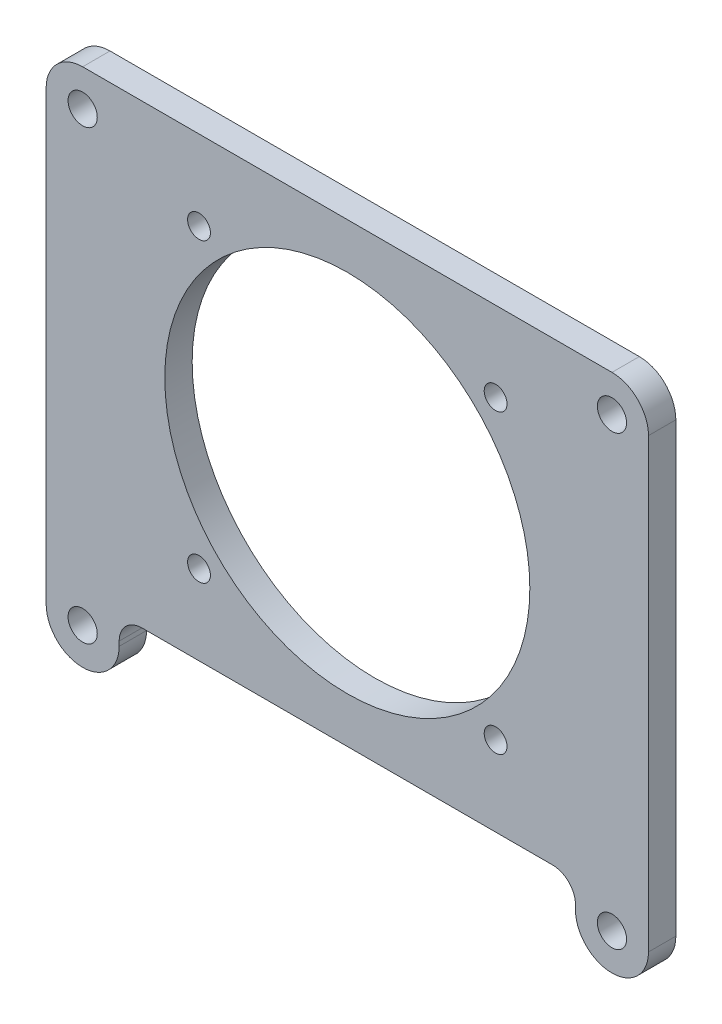
from build123d import *

# Parameters (mm, degrees)
SKETCH_1_R          = 1.6
EXTRUDE_1_DEPTH     = 3
SKETCH_2_R          = 1.25
SKETCH_2_R_2        = 20
CUT_EXTRUDE_1_DEPTH = 60.983331018


with BuildPart() as part:
    # ｽｹｯﾁ1 → ﾎﾞｽ - 押し出し1 (new body)
    with BuildSketch(Plane.XY):
        with BuildLine():
            Line((22.5, 0), (-22.5, 0))
            ThreePointArc((-22.5, 0), (-24.267766953, -0.732233047), (-25, -2.5))
            Line((-25, -2.5), (-25, -3))
            ThreePointArc((-25, -3), (-29, -7), (-33, -3))
            Line((-33, -3), (-33, 46))
            ThreePointArc((-33, 46), (-31.828427125, 48.828427125), (-29, 50))
            Line((-29, 50), (29, 50))
            ThreePointArc((29, 50), (31.828427125, 48.828427125), (33, 46))
            Line((33, 46), (33, -3))
            ThreePointArc((33, -3), (29, -7), (25, -3))
            Line((25, -3), (25, -2.5))
            ThreePointArc((25, -2.5), (24.267766953, -0.732233047), (22.5, 0))
        make_face()
        with Locations((-29, -3)):
            Circle(SKETCH_1_R, mode=Mode.SUBTRACT)
        with Locations((-29, 46)):
            Circle(SKETCH_1_R, mode=Mode.SUBTRACT)
        with Locations((29, 46)):
            Circle(SKETCH_1_R, mode=Mode.SUBTRACT)
        with Locations((29, -3)):
            Circle(SKETCH_1_R, mode=Mode.SUBTRACT)
    extrude(amount=EXTRUDE_1_DEPTH)

    # ｽｹｯﾁ2 → ｶｯﾄ - 押し出し1 (cut, through all)
    with BuildSketch(Plane.XY.offset(3)):
        with Locations((-16.25, 41.25)):
            Circle(SKETCH_2_R)
        with Locations((-16.25, 8.75)):
            Circle(SKETCH_2_R)
        with Locations((16.25, 8.75)):
            Circle(SKETCH_2_R)
        with Locations((16.25, 41.25)):
            Circle(SKETCH_2_R)
        with Locations((0, 25)):
            Circle(SKETCH_2_R_2)
    extrude(amount=-CUT_EXTRUDE_1_DEPTH, mode=Mode.SUBTRACT)


solid = part.part
